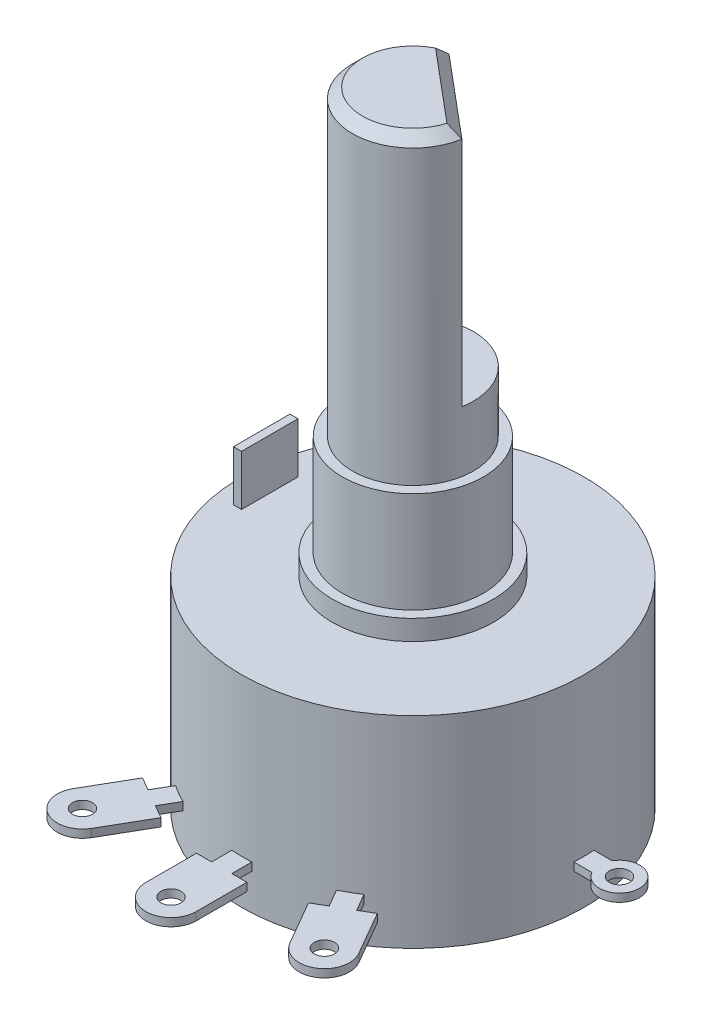
from build123d import *

# Parameters (mm, degrees)
SKETCH2_W           = 0.4
SKETCH2_H           = 2.8
BOSS_EXTRUDE1_DEPTH = 2.5
SKETCH3_R           = 0.5
BOSS_EXTRUDE2_DEPTH = 0.2
SKETCH4_R           = 3
BOSS_EXTRUDE4_DEPTH = 15
CUT_EXTRUDE1_START  = -12
CUT_EXTRUDE1_DEPTH  = 12
CHAMFER1_SIZE       = 0.5


with BuildPart() as part:
    # Sketch1 → Revolve1 (revolve)
    with BuildSketch(Plane(origin=(0, 0, 0), x_dir=(0, 0, -1), z_dir=(1, 0, 0))):
        Polygon((0, 0), (8.5, 0), (8.5, 10), (4, 10), (4, 11), (3.5, 11), (3.5, 16), (0, 16), align=None)
    revolve(axis=Axis((0, 16, 0), (0, -1, 0)))

    # Sketch2 → Boss-Extrude1 (add)
    with BuildSketch(Plane(origin=(0, 10, 0), x_dir=(1, 0, 0), z_dir=(0, 1, 0))):
        with Locations((-7.3, 0)):
            Rectangle(SKETCH2_W, SKETCH2_H)
    extrude(amount=BOSS_EXTRUDE1_DEPTH)

    # Sketch3 → Boss-Extrude2 (add, symmetric)
    # profile 1 of 5: a face of its own
    with BuildSketch(Plane(origin=(0, 2, 0), x_dir=(-1, 0, 0), z_dir=(0, -1, 0))):
        with BuildLine():
            Line((-1.25, -9.485281374), (-1.25, -12))
            ThreePointArc((-1.25, -12), (0, -13.25), (1.25, -12))
            Line((1.25, -12), (1.25, -9.485281374))
            Line((1.25, -9.485281374), (0.5, -9.485281374))
            Line((0.5, -9.485281374), (0.5, -8.485281374))
            ThreePointArc((0.5, -8.485281374), (0, -8.5), (-0.5, -8.485281374))
            Line((-0.5, -8.485281374), (-0.5, -9.485281374))
            Line((-0.5, -9.485281374), (-1.25, -9.485281374))
        make_face()
        with Locations((0, -12)):
            Circle(SKETCH3_R, mode=Mode.SUBTRACT)
    # profile 2 of 5: a face of its own
    with BuildSketch(Plane(origin=(0, 2, 0), x_dir=(-1, 0, 0), z_dir=(0, -1, 0))):
        with BuildLine():
            Line((-5.825172442, -7.589494632), (-7.082531755, -9.767304845))
            ThreePointArc((-7.082531755, -9.767304845), (-6.625, -11.4748366), (-4.917468245, -11.017304845))
            Line((-4.917468245, -11.017304845), (-3.660108932, -8.839494632))
            Line((-3.660108932, -8.839494632), (-4.309627985, -8.464494632))
            Line((-4.309627985, -8.464494632), (-3.809627985, -7.598469228))
            ThreePointArc((-3.809627985, -7.598469228), (-4.25, -7.361215932), (-4.675653389, -7.098469228))
            Line((-4.675653389, -7.098469228), (-5.175653389, -7.964494632))
            Line((-5.175653389, -7.964494632), (-5.825172442, -7.589494632))
        make_face()
        with Locations((-6, -10.392304845)):
            Circle(SKETCH3_R, mode=Mode.SUBTRACT)
    # profile 3 of 5: a face of its own
    with BuildSketch(Plane(origin=(0, 2, 0), x_dir=(-1, 0, 0), z_dir=(0, -1, 0))):
        with BuildLine():
            Line((5.175653389, -7.964494632), (4.675653389, -7.098469228))
            ThreePointArc((4.675653389, -7.098469228), (4.25, -7.361215932), (3.809627985, -7.598469228))
            Line((3.809627985, -7.598469228), (4.309627985, -8.464494632))
            Line((4.309627985, -8.464494632), (3.660108932, -8.839494632))
            Line((3.660108932, -8.839494632), (4.917468245, -11.017304845))
            ThreePointArc((4.917468245, -11.017304845), (6.625, -11.4748366), (7.082531755, -9.767304845))
            Line((7.082531755, -9.767304845), (5.825172442, -7.589494632))
            Line((5.825172442, -7.589494632), (5.175653389, -7.964494632))
        make_face()
        with Locations((6, -10.392304845)):
            Circle(SKETCH3_R, mode=Mode.SUBTRACT)
    # profile 4 of 5: a face of its own
    with BuildSketch(Plane(origin=(0, 2, 0), x_dir=(-1, 0, 0), z_dir=(0, -1, 0))):
        with BuildLine():
            Line((9.383974596, 0.5), (8.485281374, 0.5))
            ThreePointArc((8.485281374, 0.5), (8.5, 0), (8.485281374, -0.5))
            Line((8.485281374, -0.5), (9.383974596, -0.5))
            ThreePointArc((9.383974596, -0.5), (11.25, 0), (9.383974596, 0.5))
        make_face()
        with Locations((10.25, 0)):
            Circle(SKETCH3_R, mode=Mode.SUBTRACT)
    # profile 5 of 5: a face of its own
    with BuildSketch(Plane(origin=(0, 2, 0), x_dir=(-1, 0, 0), z_dir=(0, -1, 0))):
        with BuildLine():
            Line((-9.383974596, -0.5), (-8.485281374, -0.5))
            ThreePointArc((-8.485281374, -0.5), (-8.5, 0), (-8.485281374, 0.5))
            Line((-8.485281374, 0.5), (-9.383974596, 0.5))
            ThreePointArc((-9.383974596, 0.5), (-11.25, 0), (-9.383974596, -0.5))
        make_face()
        with Locations((-10.25, 0)):
            Circle(SKETCH3_R, mode=Mode.SUBTRACT)
    extrude(amount=BOSS_EXTRUDE2_DEPTH, both=True)

    # Sketch4 → Boss-Extrude4 (add)
    with BuildSketch(Plane(origin=(0, 16, 0), x_dir=(1, 0, 0), z_dir=(0, 1, 0))):
        Circle(SKETCH4_R)
    extrude(amount=BOSS_EXTRUDE4_DEPTH)

    # Sketch5 → Cut-Extrude1 (cut)
    with BuildSketch(Plane(origin=(0, 31, 0), x_dir=(1, 0, 0), z_dir=(0, 1, 0)).offset(CUT_EXTRUDE1_START)):
        with BuildLine():
            Line((2.954423259, -0.520944533), (-1.02606043, 2.819077862))
            ThreePointArc((-1.02606043, 2.819077862), (1.928362829, 2.298133329), (2.954423259, -0.520944533))
        make_face()
    extrude(amount=CUT_EXTRUDE1_DEPTH, mode=Mode.SUBTRACT)

    # Chamfer1
    chamfer1_edges = [part.edges().sort_by_distance(p)[0] for p in [
        (-1.928362829, 31, 2.298133329),
        (0.964181415, 31, -1.149066665),
    ]]
    chamfer(chamfer1_edges, length=CHAMFER1_SIZE)


solid = part.part
